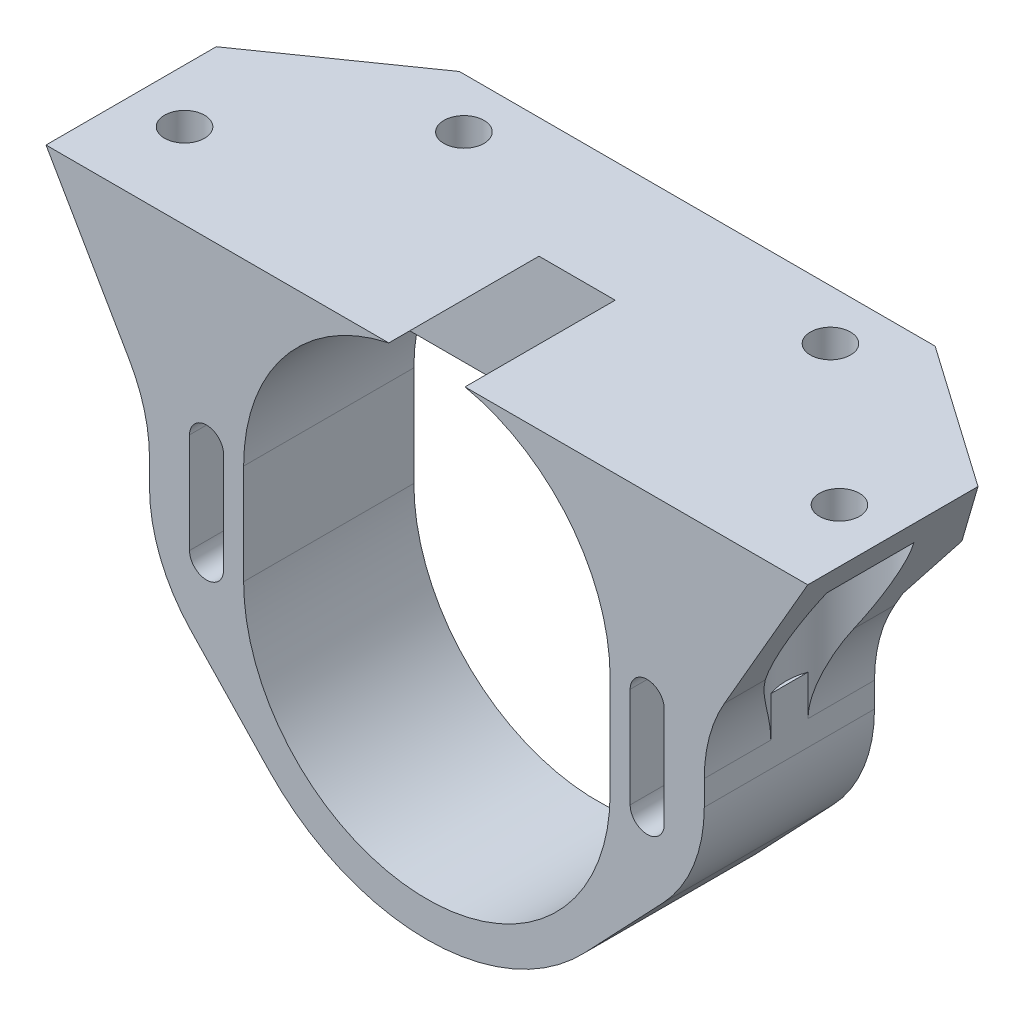
from build123d import *

# Parameters (mm, degrees)
BOSS_EXTRUDE1_DEPTH = 17
BOSS_EXTRUDE2_START = -17
BOSS_EXTRUDE2_DEPTH = 2
SKETCH3_R           = 2
CUT_EXTRUDE2_DEPTH  = 53.410576235
SKETCH4_R           = 5.334569818
CUT_EXTRUDE3_DEPTH  = 14
SKETCH5_R           = 2
BOSS_EXTRUDE3_DEPTH = 3
CUT_EXTRUDE4_DEPTH  = 57.452356029
CHAMFER2_SIZE       = 10
FILLET1_R           = 15
FILLET2_R           = 15
SKETCH7_R           = 5
CUT_EXTRUDE6_DEPTH  = 62.913395196


with BuildPart() as part:
    # Sketch1 → Boss-Extrude1 (new body)
    with BuildSketch(Plane.XY):
        with BuildLine():
            Line((38.034569818, 17.9), (3.805259518, 17.9))
            ThreePointArc((3.805259518, 17.9), (14.221924082, 11.51637423), (18.3, 0))
            Line((18.3, 0), (18.3, -10))
            ThreePointArc((18.3, -10), (0, -28.3), (-18.3, -10))
            Line((-18.3, -10), (-18.3, 0))
            ThreePointArc((-18.3, 0), (-14.221924082, 11.51637423), (-3.805259518, 17.9))
            Line((-3.805259518, 17.9), (-38.034569818, 17.9))
            Line((-38.034569818, 17.9), (-27.7, 0))
            Line((-27.7, 0), (-27.7, -12.5))
            Line((-27.7, -12.5), (-15.801197979, -25.018726392))
            ThreePointArc((-15.801197979, -25.018726392), (0, -31.8), (15.801197979, -25.018726392))
            Line((15.801197979, -25.018726392), (27.7, -12.5))
            Line((27.7, -12.5), (27.7, 0))
            Line((27.7, 0), (38.034569818, 17.9))
        make_face()
        with BuildLine():
            Line((23.7, 0), (23.7, -10))
            ThreePointArc((23.7, -10), (22, -11.7), (20.3, -10))
            Line((20.3, -10), (20.3, 0))
            ThreePointArc((20.3, 0), (22, 1.7), (23.7, 0))
        make_face(mode=Mode.SUBTRACT)
        with BuildLine():
            Line((-23.7, 0), (-23.7, -10))
            ThreePointArc((-23.7, -10), (-22, -11.7), (-20.3, -10))
            Line((-20.3, -10), (-20.3, 0))
            ThreePointArc((-20.3, 0), (-22, 1.7), (-23.7, 0))
        make_face(mode=Mode.SUBTRACT)
    extrude(amount=BOSS_EXTRUDE1_DEPTH)

    # Sketch2 → Boss-Extrude2 (add)
    with BuildSketch(Plane.XY.offset(17).offset(BOSS_EXTRUDE2_START)):
        Polygon((38.034569818, 17.9), (-38.034569818, 17.9), (-30.586751346, 5), (30.586751346, 5), align=None)
    extrude(amount=BOSS_EXTRUDE2_DEPTH)

    # Sketch3 → Cut-Extrude2 (cut, through all)
    with BuildSketch(Plane(origin=(0, 0, 0), x_dir=(1, 0, 0), z_dir=(0, 1, 0))):
        with Locations(Location((32.7, -8.5, 0), (0, 0, 180))):
            Circle(SKETCH3_R)
    cut_extrude2 = extrude(amount=CUT_EXTRUDE2_DEPTH, mode=Mode.SUBTRACT)

    # Sketch4 → Cut-Extrude3 (cut)
    with BuildSketch(Plane(origin=(0, 0, 0), x_dir=(1, 0, 0), z_dir=(0, 1, 0))):
        with Locations((32.7, -8.5)):
            Circle(SKETCH4_R)
    cut_extrude3 = extrude(amount=CUT_EXTRUDE3_DEPTH, mode=Mode.SUBTRACT)

    # Sketch5 → Boss-Extrude3 (add)
    with BuildSketch(Plane(origin=(0, 17.9, 0), x_dir=(1, 0, 0), z_dir=(0, 1, 0))):
        Polygon((-38.034569818, 0), (-23.753089751, 10), (0, 10), (0, 0), align=None)
        with Locations(Location((-18.3, 5, 0), (0, 0, 180))):
            Circle(SKETCH5_R, mode=Mode.SUBTRACT)
    boss_extrude3 = extrude(amount=-BOSS_EXTRUDE3_DEPTH)

    # Sketch6 → Cut-Extrude4 (cut, through all)
    with BuildSketch(Plane(origin=(0, 0, -10), x_dir=(-1, 0, 0), z_dir=(0, 0, -1))):
        Polygon((36.302519011, 14.9), (38.034569818, 17.9), (38.034569818, 14.9), align=None)
    cut_extrude4 = extrude(amount=-CUT_EXTRUDE4_DEPTH, mode=Mode.SUBTRACT)

    # Mirror2: Cut-Extrude2, Cut-Extrude3, Boss-Extrude3 across plane
    add(cut_extrude2.mirror(Plane(origin=(0, 14.9, -10), x_dir=(0, 0, 1), z_dir=(1, 0, 0))), mode=Mode.SUBTRACT)
    add(cut_extrude3.mirror(Plane(origin=(0, 14.9, -10), x_dir=(0, 0, 1), z_dir=(1, 0, 0))), mode=Mode.SUBTRACT)
    add(boss_extrude3.mirror(Plane(origin=(0, 14.9, -10), x_dir=(0, 0, 1), z_dir=(1, 0, 0))))

    # Mirror3: Cut-Extrude2, Cut-Extrude3, Cut-Extrude4 across plane
    add(cut_extrude2.mirror(Plane(origin=(0, 0, 0), x_dir=(0, 0, 1), z_dir=(1, 0, 0))), mode=Mode.SUBTRACT)
    add(cut_extrude3.mirror(Plane(origin=(0, 0, 0), x_dir=(0, 0, 1), z_dir=(1, 0, 0))), mode=Mode.SUBTRACT)
    add(cut_extrude4.mirror(Plane(origin=(0, 0, 0), x_dir=(0, 0, 1), z_dir=(1, 0, 0))), mode=Mode.SUBTRACT)

    # Chamfer2
    # the kernel refuses this chamfer: 10 mm, written as the material it adds along each edge
    with BuildSketch(Plane(origin=(-62.019348891, 14.9, 0), x_dir=(0, 0.027495876610586317, -0.9996219169112968), z_dir=(1, 0, 0))) as chamfer2_piece_1_section:
        Polygon((CHAMFER2_SIZE * 0.999621916911, -CHAMFER2_SIZE * 0.0274958766106), (-CHAMFER2_SIZE * 0.0274958766106, -CHAMFER2_SIZE * 0.999621916911), (0, 0), align=None)
    chamfer2_piece_1 = extrude(amount=124.038697781, mode=Mode.PRIVATE)
    chamfer2_piece_1 = chamfer2_piece_1 - Plane(origin=(18.3, 11.716008288, -5), x_dir=(1, 0, 0), z_dir=(0, 1, 0)) * Cylinder(2, 289, mode=Mode.PRIVATE)
    chamfer2_piece_1 = chamfer2_piece_1 - Plane(origin=(-18.3, 11.716008288, -5), x_dir=(-1, 0, 0), z_dir=(0, 1, 0)) * Cylinder(2, 289, mode=Mode.PRIVATE)
    chamfer2_piece_1 = split(chamfer2_piece_1, bisect_by=Plane(origin=(-4.622195202, 11.716008288, -29.868588423), z_dir=(-0.5735764363510418, 0, 0.819152044288995)), keep=Keep.TOP, mode=Mode.PRIVATE)
    chamfer2_piece_1 = split(chamfer2_piece_1, bisect_by=Plane(origin=(-26.779856727, 11.716008288, -7.880634947), z_dir=(0.5735764363510418, 0, 0.819152044288995)), keep=Keep.TOP, mode=Mode.PRIVATE)
    chamfer2_piece_1 = split(chamfer2_piece_1, bisect_by=Plane(origin=(-31.697953242, 6.924658142, -3.052401614), z_dir=(0.8660254037844364, 0.500000000000004, 0)), keep=Keep.TOP, mode=Mode.PRIVATE)
    chamfer2_piece_1 = chamfer2_piece_1 - Plane(origin=(0, 0, -3.052401614), x_dir=(-1, 0, 0), z_dir=(0, 0, -1)) * Cylinder(18.3, 289, mode=Mode.PRIVATE)
    chamfer2_piece_1 = split(chamfer2_piece_1, bisect_by=Plane(origin=(19.998407566, -13.339549394, -3.052401614), z_dir=(-0.8660254037844365, 0.5000000000000038, 0)), keep=Keep.TOP, mode=Mode.PRIVATE)
    add(chamfer2_piece_1)
    with BuildSketch(Plane(origin=(-62.019348891, 14.9, 0), x_dir=(0, 0.027495876610586317, -0.9996219169112968), z_dir=(1, 0, 0))) as chamfer2_piece_2_section:
        Polygon((CHAMFER2_SIZE * 0.999621916911, -CHAMFER2_SIZE * 0.0274958766106), (-CHAMFER2_SIZE * 0.0274958766106, -CHAMFER2_SIZE * 0.999621916911), (0, 0), align=None)
    chamfer2_piece_2 = extrude(amount=124.038697781, mode=Mode.PRIVATE)
    chamfer2_piece_2 = split(chamfer2_piece_2, bisect_by=Plane(origin=(0, 5, -3.178355845), z_dir=(0, 1, 0)), keep=Keep.TOP, mode=Mode.PRIVATE)
    chamfer2_piece_2 = chamfer2_piece_2 & Plane(origin=(0, 0, -3.178355845), x_dir=(-1, 0, 0), z_dir=(0, 0, -1)) * Cylinder(18.3, 289, mode=Mode.PRIVATE)
    add(chamfer2_piece_2)

    # Fillet1
    fillet1_edges = [part.edges().sort_by_distance(p)[0] for p in [
        (27.7, -12.5, 8.5),
        (-27.7, -12.5, 8.5),
    ]]
    fillet(fillet1_edges, radius=FILLET1_R)

    # Fillet2
    fillet2_edges = [part.edges().sort_by_distance(p)[0] for p in [
        (27.7, 0, 13.67973587),
        (27.7, 0, 3.32026413),
        (-27.7, 0, 13.67973587),
        (-27.7, 0, 3.32026413),
    ]]
    fillet(fillet2_edges, radius=FILLET2_R)

    # Sketch7 → Cut-Extrude6 (cut, through all)
    with BuildSketch(Plane.XZ.offset(-14)):
        with Locations((-18.3, -5)):
            Circle(SKETCH7_R)
    cut_extrude6 = extrude(amount=CUT_EXTRUDE6_DEPTH, mode=Mode.SUBTRACT)

    # Mirror4: Cut-Extrude6 across plane
    add(cut_extrude6.mirror(Plane(origin=(0, 0, 0), x_dir=(0, 0, 1), z_dir=(1, 0, 0))), mode=Mode.SUBTRACT)


solid = part.part
